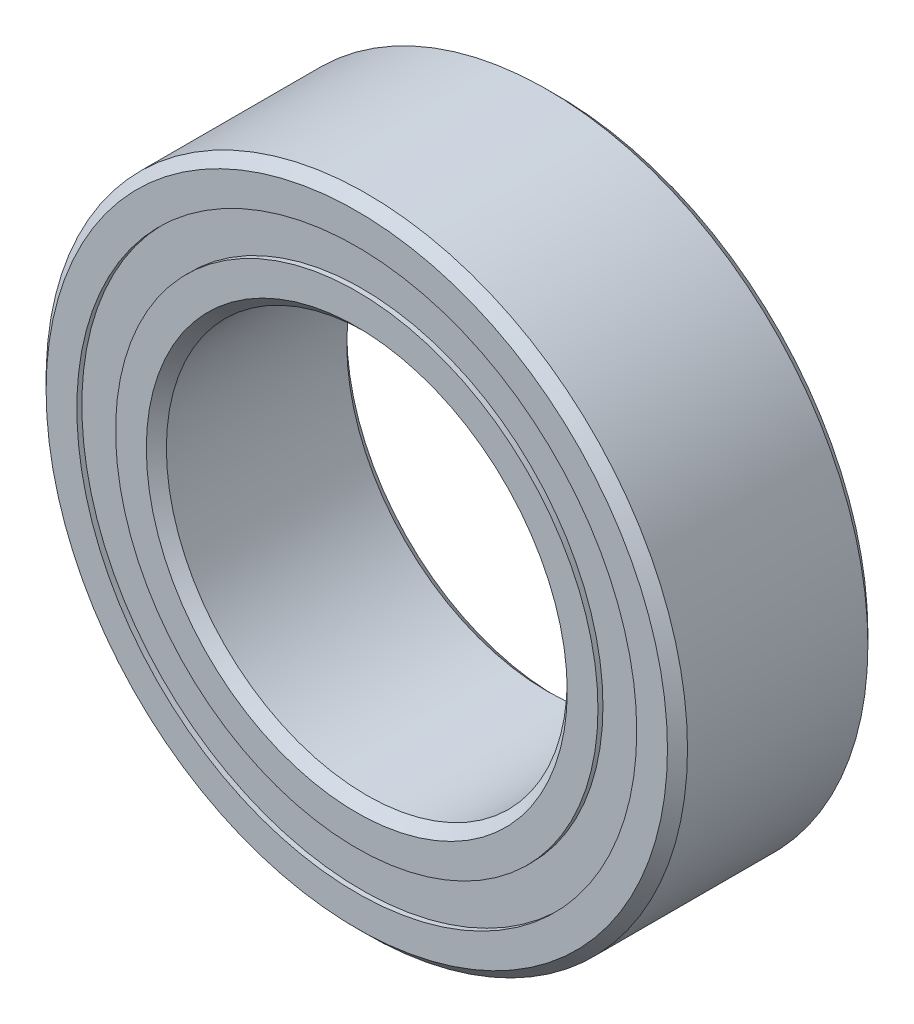
from build123d import *

# Parameters (mm, degrees)
CIRPATTERN1_COUNT = 16
SKETCH5_W         = 0.923323783
SKETCH5_H         = 0.767582418


with BuildPart() as part:
    # Sketch1 → Revolve1 (revolve)
    with BuildSketch(Plane(origin=(0, 0, 0), x_dir=(0, 0, -1), z_dir=(1, 0, 0))):
        with BuildLine():
            Line((1.7859375, 6.35), (-1.7859375, 6.35))
            Line((-1.7859375, 6.35), (-1.984375, 6.1515625))
            Line((-1.984375, 6.1515625), (-1.984375, 5.543166209))
            Line((-1.984375, 5.543166209), (-0.881944444, 5.543166209))
            ThreePointArc((-0.881944444, 5.543166209), (0, 6.121207467), (0.881944444, 5.543166209))
            Line((0.881944444, 5.543166209), (1.984375, 5.543166209))
            Line((1.984375, 5.543166209), (1.984375, 6.1515625))
            Line((1.984375, 6.1515625), (1.7859375, 6.35))
        make_face()
    revolve(axis=Axis((0, 0, 1.984375), (0, 0, -1)))


with BuildPart() as body_2:
    # Sketch3 → Revolve3 (revolve)
    with BuildSketch(Plane(origin=(0, 0, 0), x_dir=(0, 0, -1), z_dir=(1, 0, 0))):
        with BuildLine():
            Line((-0.881944444, 4.775583791), (-1.984375, 4.775583791))
            Line((-1.984375, 4.775583791), (-1.984375, 4.1671875))
            Line((-1.984375, 4.1671875), (-1.7859375, 3.96875))
            Line((-1.7859375, 3.96875), (1.7859375, 3.96875))
            Line((1.7859375, 3.96875), (1.984375, 4.1671875))
            Line((1.984375, 4.1671875), (1.984375, 4.775583791))
            Line((1.984375, 4.775583791), (0.881944444, 4.775583791))
            ThreePointArc((0.881944444, 4.775583791), (0, 4.197542533), (-0.881944444, 4.775583791))
        make_face()
    revolve(axis=Axis((0, 0, 1.984375), (0, 0, -1)))


with BuildPart() as body_3:
    # Sketch4 → Revolve4 (revolve)
    with BuildSketch(Plane(origin=(0, 0, 0), x_dir=(0, 0, -1), z_dir=(1, 0, 0))):
        with BuildLine():
            Line((-0.961832467, 5.159375), (0.961832467, 5.159375))
            ThreePointArc((0.961832467, 5.159375), (0, 6.121207467), (-0.961832467, 5.159375))
        make_face()
    revolve(axis=Axis((0, 5.159375, 0.961832467), (0, 0, -1)))


with BuildPart() as cirpattern1_1:
    # CirPattern1: pattern copy
    add(body_3.part.rotate(Axis((0, 0, -1.984375), (0, 0, 1)), 1 * 360 / CIRPATTERN1_COUNT))


with BuildPart() as cirpattern1_2:
    # CirPattern1: pattern copy
    add(body_3.part.rotate(Axis((0, 0, -1.984375), (0, 0, 1)), 2 * 360 / CIRPATTERN1_COUNT))


with BuildPart() as cirpattern1_3:
    # CirPattern1: pattern copy
    add(body_3.part.rotate(Axis((0, 0, -1.984375), (0, 0, 1)), 3 * 360 / CIRPATTERN1_COUNT))


with BuildPart() as cirpattern1_4:
    # CirPattern1: pattern copy
    add(body_3.part.rotate(Axis((0, 0, -1.984375), (0, 0, 1)), 4 * 360 / CIRPATTERN1_COUNT))


with BuildPart() as cirpattern1_5:
    # CirPattern1: pattern copy
    add(body_3.part.rotate(Axis((0, 0, -1.984375), (0, 0, 1)), 5 * 360 / CIRPATTERN1_COUNT))


with BuildPart() as cirpattern1_6:
    # CirPattern1: pattern copy
    add(body_3.part.rotate(Axis((0, 0, -1.984375), (0, 0, 1)), 6 * 360 / CIRPATTERN1_COUNT))


with BuildPart() as cirpattern1_7:
    # CirPattern1: pattern copy
    add(body_3.part.rotate(Axis((0, 0, -1.984375), (0, 0, 1)), 7 * 360 / CIRPATTERN1_COUNT))


with BuildPart() as cirpattern1_8:
    # CirPattern1: pattern copy
    add(body_3.part.rotate(Axis((0, 0, -1.984375), (0, 0, 1)), 8 * 360 / CIRPATTERN1_COUNT))


with BuildPart() as cirpattern1_9:
    # CirPattern1: pattern copy
    add(body_3.part.rotate(Axis((0, 0, -1.984375), (0, 0, 1)), 9 * 360 / CIRPATTERN1_COUNT))


with BuildPart() as cirpattern1_10:
    # CirPattern1: pattern copy
    add(body_3.part.rotate(Axis((0, 0, -1.984375), (0, 0, 1)), 10 * 360 / CIRPATTERN1_COUNT))


with BuildPart() as cirpattern1_11:
    # CirPattern1: pattern copy
    add(body_3.part.rotate(Axis((0, 0, -1.984375), (0, 0, 1)), 11 * 360 / CIRPATTERN1_COUNT))


with BuildPart() as cirpattern1_12:
    # CirPattern1: pattern copy
    add(body_3.part.rotate(Axis((0, 0, -1.984375), (0, 0, 1)), 12 * 360 / CIRPATTERN1_COUNT))


with BuildPart() as cirpattern1_13:
    # CirPattern1: pattern copy
    add(body_3.part.rotate(Axis((0, 0, -1.984375), (0, 0, 1)), 13 * 360 / CIRPATTERN1_COUNT))


with BuildPart() as cirpattern1_14:
    # CirPattern1: pattern copy
    add(body_3.part.rotate(Axis((0, 0, -1.984375), (0, 0, 1)), 14 * 360 / CIRPATTERN1_COUNT))


with BuildPart() as cirpattern1_15:
    # CirPattern1: pattern copy
    add(body_3.part.rotate(Axis((0, 0, -1.984375), (0, 0, 1)), 15 * 360 / CIRPATTERN1_COUNT))


with BuildPart() as body_19:
    # Sketch5 → Revolve5 (revolve)
    with BuildSketch(Plane(origin=(0, 0, 0), x_dir=(0, 0, -1), z_dir=(1, 0, 0))):
        with Locations((-1.423494359, 5.159375)):
            Rectangle(SKETCH5_W, SKETCH5_H)
        with Locations((1.423494359, 5.159375)):
            Rectangle(SKETCH5_W, SKETCH5_H)
    revolve(axis=Axis((0, 0, 1.984375), (0, 0, -1)))


solid = Compound([part.part, body_2.part, body_3.part, cirpattern1_1.part, cirpattern1_2.part, cirpattern1_3.part, cirpattern1_4.part, cirpattern1_5.part, cirpattern1_6.part, cirpattern1_7.part, cirpattern1_8.part, cirpattern1_9.part, cirpattern1_10.part, cirpattern1_11.part, cirpattern1_12.part, cirpattern1_13.part, cirpattern1_14.part, cirpattern1_15.part, body_19.part])
